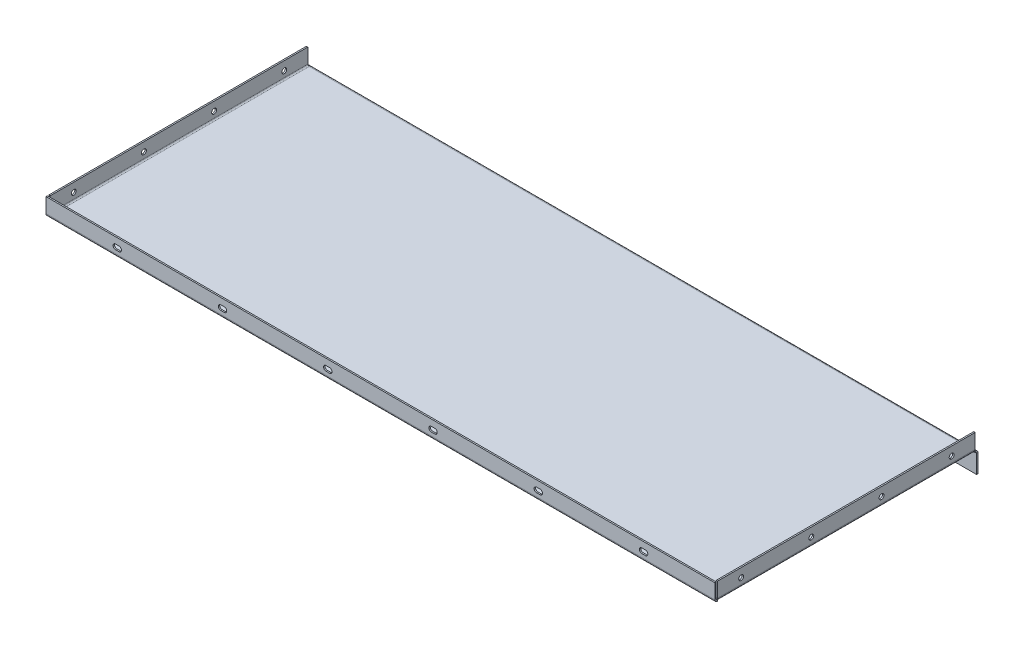
from build123d import *

# Parameters (mm, degrees)
SKETCH1_W                    = 1906
SKETCH1_H                    = 750
BASE_FLANGE1_DEPTH           = 4
EDGE_FLANGE1_STRIP_W         = 24
EDGE_FLANGE1_STRIP_H         = 4
EDGE_FLANGE1_STRIP_CUT_DEPTH = 1906
EDGE_FLANGE1_DEPTH           = 1906
EDGE_FLANGE2_STRIP_W         = 24
EDGE_FLANGE2_STRIP_H         = 4
EDGE_FLANGE2_STRIP_CUT_DEPTH = 1906
EDGE_FLANGE2_DEPTH           = 1906
EDGE_FLANGE3_STRIP_W         = 24
EDGE_FLANGE3_STRIP_H         = 4
EDGE_FLANGE3_STRIP_CUT_DEPTH = 734
EDGE_FLANGE3_DEPTH           = 734
EDGE_FLANGE4_STRIP_W         = 24
EDGE_FLANGE4_STRIP_H         = 4
EDGE_FLANGE4_STRIP_CUT_DEPTH = 734
EDGE_FLANGE4_DEPTH           = 734
SKETCH18_R                   = 7
CUT_EXTRUDE4_DEPTH           = 1979.516472174
LPATTERN1_COUNT              = 4
LPATTERN1_PITCH              = 200
CUT_EXTRUDE5_DEPTH           = 10
LPATTERN2_COUNT              = 6
LPATTERN2_PITCH              = 300
CUT_EXTRUDE6_DEPTH           = 1545.720516034
LPATTERN3_COUNT              = 6
LPATTERN3_PITCH              = 300


# Sheet-metal steps are written as plain solids
with BuildPart() as part:
    # Sketch1 → Base-Flange1 (new body)
    with BuildSketch(Plane(origin=(0, 0, 0), x_dir=(1, 0, 0), z_dir=(0, 1, 0))):
        with Locations((398.3125, 152.34375)):
            Rectangle(SKETCH1_W, SKETCH1_H)
    extrude(amount=-BASE_FLANGE1_DEPTH)

    # Edge-Flange1 strip (across the edge) → Edge-Flange1 strip cut (cut)
    with BuildSketch(Plane(origin=(-554.6875, -4, -527.34375), x_dir=(0, 0, 1), z_dir=(1, 0, 0))):
        with Locations((-4, -2)):
            Rectangle(EDGE_FLANGE1_STRIP_W, EDGE_FLANGE1_STRIP_H)
    extrude(amount=EDGE_FLANGE1_STRIP_CUT_DEPTH, mode=Mode.SUBTRACT)

    # Edge-Flange1 section (across the edge) → Edge-Flange1 (add)
    with BuildSketch(Plane(origin=(-554.6875, -4, -527.34375), x_dir=(0, 0, 1), z_dir=(1, 0, 0))):
        with BuildLine():
            Line((0, 4), (0, 56))
            Line((0, 56), (4, 56))
            Line((4, 56), (4, 4))
            ThreePointArc((4, 4), (5.171572875, 1.171572875), (8, 0))
            Line((8, 0), (8, -4))
            ThreePointArc((8, -4), (2.343145751, -1.656854249), (0, 4))
        make_face()
    extrude(amount=EDGE_FLANGE1_DEPTH)

    # Edge-Flange2 strip (across the edge) → Edge-Flange2 strip cut (cut)
    with BuildSketch(Plane(origin=(-554.6875, 0, 222.65625), x_dir=(0, 0, -1), z_dir=(1, 0, 0))):
        with Locations((-4, -2)):
            Rectangle(EDGE_FLANGE2_STRIP_W, EDGE_FLANGE2_STRIP_H)
    extrude(amount=EDGE_FLANGE2_STRIP_CUT_DEPTH, mode=Mode.SUBTRACT)

    # Edge-Flange2 section (across the edge) → Edge-Flange2 (add)
    with BuildSketch(Plane(origin=(-554.6875, 0, 222.65625), x_dir=(0, 0, -1), z_dir=(1, 0, 0))):
        with BuildLine():
            Line((0, 4), (0, 46))
            Line((0, 46), (4, 46))
            Line((4, 46), (4, 4))
            ThreePointArc((4, 4), (5.171572875, 1.171572875), (8, 0))
            Line((8, 0), (8, -4))
            ThreePointArc((8, -4), (2.343145751, -1.656854249), (0, 4))
        make_face()
    extrude(amount=EDGE_FLANGE2_DEPTH)

    # Edge-Flange3 strip (across the edge) → Edge-Flange3 strip cut (cut)
    with BuildSketch(Plane(origin=(1351.3125, 0, 214.65625), x_dir=(-1, 0, 0), z_dir=(0, 0, -1))):
        with Locations((-4, -2)):
            Rectangle(EDGE_FLANGE3_STRIP_W, EDGE_FLANGE3_STRIP_H)
    extrude(amount=EDGE_FLANGE3_STRIP_CUT_DEPTH, mode=Mode.SUBTRACT)

    # Edge-Flange3 section (across the edge) → Edge-Flange3 (add)
    with BuildSketch(Plane(origin=(1351.3125, 0, 214.65625), x_dir=(-1, 0, 0), z_dir=(0, 0, -1))):
        with BuildLine():
            Line((0, 4), (0, 46))
            Line((0, 46), (4, 46))
            Line((4, 46), (4, 4))
            ThreePointArc((4, 4), (5.171572875, 1.171572875), (8, 0))
            Line((8, 0), (8, -4))
            ThreePointArc((8, -4), (2.343145751, -1.656854249), (0, 4))
        make_face()
    extrude(amount=EDGE_FLANGE3_DEPTH)

    # Edge-Flange4 strip (across the edge) → Edge-Flange4 strip cut (cut)
    with BuildSketch(Plane(origin=(-554.6875, 0, -519.34375), x_dir=(1, 0, 0), z_dir=(0, 0, 1))):
        with Locations((-4, -2)):
            Rectangle(EDGE_FLANGE4_STRIP_W, EDGE_FLANGE4_STRIP_H)
    extrude(amount=EDGE_FLANGE4_STRIP_CUT_DEPTH, mode=Mode.SUBTRACT)

    # Edge-Flange4 section (across the edge) → Edge-Flange4 (add)
    with BuildSketch(Plane(origin=(-554.6875, 0, -519.34375), x_dir=(1, 0, 0), z_dir=(0, 0, 1))):
        with BuildLine():
            Line((0, 4), (0, 46))
            Line((0, 46), (4, 46))
            Line((4, 46), (4, 4))
            ThreePointArc((4, 4), (5.171572875, 1.171572875), (8, 0))
            Line((8, 0), (8, -4))
            ThreePointArc((8, -4), (2.343145751, -1.656854249), (0, 4))
        make_face()
    extrude(amount=EDGE_FLANGE4_DEPTH)

    # Sketch18 → Cut-Extrude4 (cut, symmetric)
    with BuildSketch(Plane(origin=(1351.3125, 0, 0), x_dir=(0, 0, -1), z_dir=(1, 0, 0))):
        with Locations(Location((-147.65625, 21, 0), (0, 0, 90))):
            Circle(SKETCH18_R)
    cut_extrude4 = extrude(amount=CUT_EXTRUDE4_DEPTH, both=True, mode=Mode.SUBTRACT)

    # LPattern1: Cut-Extrude4 ×4
    with Locations(*[(0, 0, -i * LPATTERN1_PITCH) for i in range(1, LPATTERN1_COUNT)]):
        add(cut_extrude4, mode=Mode.SUBTRACT)

    # Sketch19 → Cut-Extrude5 (cut)
    with BuildSketch(Plane.XY.offset(222.65625)):
        with BuildLine():
            Line((1153.3125, 14), (1143.3125, 14))
            ThreePointArc((1143.3125, 14), (1136.3125, 21), (1143.3125, 28))
            Line((1143.3125, 28), (1153.3125, 28))
            ThreePointArc((1153.3125, 28), (1160.3125, 21), (1153.3125, 14))
        make_face()
    cut_extrude5 = extrude(amount=-CUT_EXTRUDE5_DEPTH, mode=Mode.SUBTRACT)

    # LPattern2: Cut-Extrude5 ×6
    with Locations(*[(-i * LPATTERN2_PITCH, 0, 0) for i in range(1, LPATTERN2_COUNT)]):
        add(cut_extrude5, mode=Mode.SUBTRACT)

    # Sketch20 → Cut-Extrude6 (cut, symmetric)
    with BuildSketch(Plane.XY.offset(-523.34375)):
        with BuildLine():
            Line((-351.6875, -28), (-341.6875, -28))
            ThreePointArc((-341.6875, -28), (-334.6875, -35), (-341.6875, -42))
            Line((-341.6875, -42), (-351.6875, -42))
            ThreePointArc((-351.6875, -42), (-358.6875, -35), (-351.6875, -28))
        make_face()
    cut_extrude6 = extrude(amount=CUT_EXTRUDE6_DEPTH, both=True, mode=Mode.SUBTRACT)

    # LPattern3: Cut-Extrude6 ×6
    with Locations(*[(i * LPATTERN3_PITCH, 0, 0) for i in range(1, LPATTERN3_COUNT)]):
        add(cut_extrude6, mode=Mode.SUBTRACT)


solid = part.part
